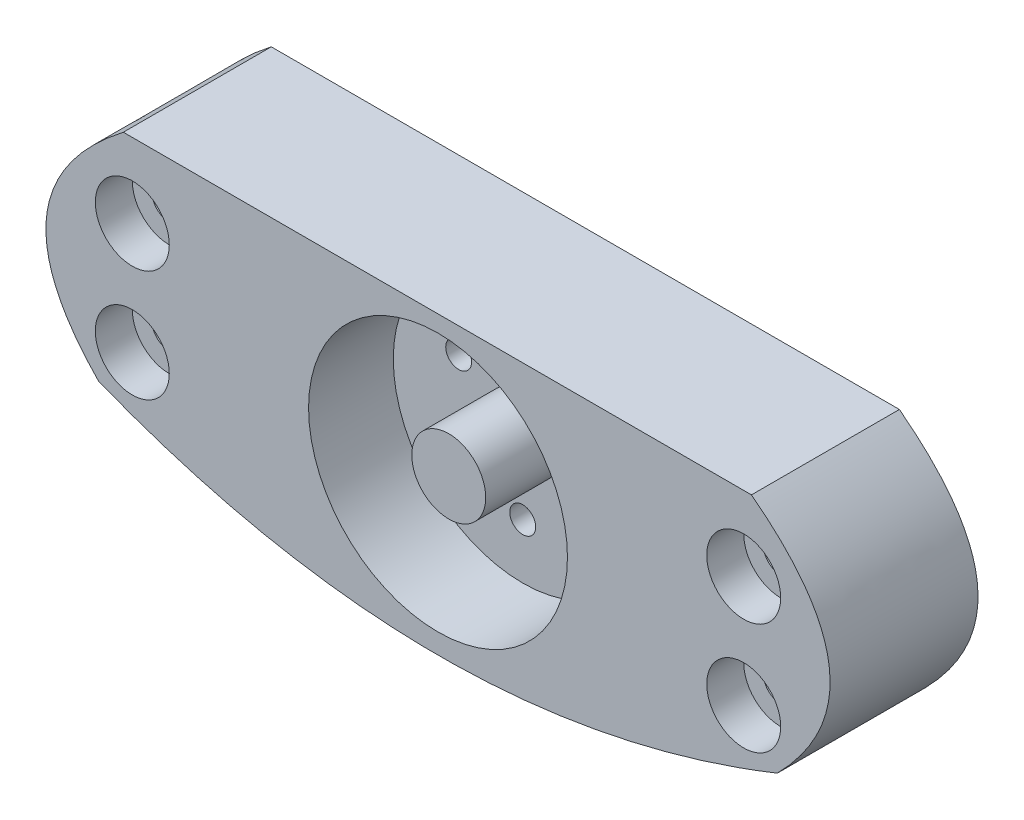
from build123d import *

# Parameters (mm, degrees)
BOSS_EXTRUDE1_DEPTH                              = 20
SKETCH4_R                                        = 17.5
CUT_EXTRUDE1_DEPTH                               = 11.453250926
SKETCH5_R                                        = 5
BOSS_EXTRUDE2_DEPTH                              = 10
CBORE_FOR_M5_HEX_HEAD_MACHINE_SCREW2_D           = 3.5
CBORE_FOR_M5_HEX_HEAD_MACHINE_SCREW2_DEPTH       = 11
CBORE_FOR_M5_HEX_HEAD_MACHINE_SCREW2_CBORE_D     = 7
CBORE_FOR_M5_HEX_HEAD_MACHINE_SCREW2_CBORE_DEPTH = 4
CBORE_FOR_M5_HEX_HEAD_MACHINE_SCREW2_TIP         = 1.75
CBORE_FOR_M5_HEX_HEAD_BOLT2_D                    = 4.7
CBORE_FOR_M5_HEX_HEAD_BOLT2_DEPTH                = 10
CBORE_FOR_M5_HEX_HEAD_BOLT2_CBORE_D              = 10
CBORE_FOR_M5_HEX_HEAD_BOLT2_CBORE_DEPTH          = 5
CBORE_FOR_M5_HEX_HEAD_BOLT2_TIP                  = 2.35


with BuildPart() as part:
    # Sketch2 → Boss-Extrude1 (new body)
    with BuildSketch(Plane.XY):
        with BuildLine():
            Line((42.376776125, 8.683218748), (-42.540089832, 8.683218747))
            add(Edge.make_bspline(
                [(-42.540089832, 8.683218747), (-61.647606257, -6.072667773), (-45.873698376, -22.15549797)],
                knots=[0, 0, 0, 1, 1, 1], degree=2))
            add(Edge.make_bspline(
                [(-45.873698376, -22.15549797), (0.203235462, -40.398996626), (45.873698397, -22.155497949)],
                knots=[0, 0, 0, 1, 1, 1], degree=2))
            add(Edge.make_bspline(
                [(45.873698397, -22.155497949), (61.713202875, -6.005950809), (42.376776125, 8.683218748)],
                knots=[0, 0, 0, 1, 1, 1], degree=2))
        make_face()
    extrude(amount=BOSS_EXTRUDE1_DEPTH)

    # Sketch4 → Cut-Extrude1 (cut)
    with BuildSketch(Plane.XY.offset(20)):
        with Locations((0, -11.063024907)):
            Circle(SKETCH4_R)
    extrude(amount=-CUT_EXTRUDE1_DEPTH, mode=Mode.SUBTRACT)

    # Sketch5 → Boss-Extrude2 (add)
    with BuildSketch(Plane.XY.offset(8.546749074)):
        with Locations((0, -11.063024907)):
            Circle(SKETCH5_R)
    extrude(amount=BOSS_EXTRUDE2_DEPTH)

    # CBORE for M5 Hex Head Machine Screw2
    with Locations(Plane(origin=(0, 0, 0), x_dir=(-1, 0, 0), z_dir=(0, 0, -1))):
        with Locations((-8.660254038, -6.129479586), (0, -21.129479586), (8.660254038, -6.129479586)):
            CounterBoreHole(CBORE_FOR_M5_HEX_HEAD_MACHINE_SCREW2_D / 2, CBORE_FOR_M5_HEX_HEAD_MACHINE_SCREW2_CBORE_D / 2, CBORE_FOR_M5_HEX_HEAD_MACHINE_SCREW2_CBORE_DEPTH, depth=CBORE_FOR_M5_HEX_HEAD_MACHINE_SCREW2_DEPTH)
            with Locations((0, 0, -(CBORE_FOR_M5_HEX_HEAD_MACHINE_SCREW2_DEPTH + CBORE_FOR_M5_HEX_HEAD_MACHINE_SCREW2_TIP / 2))):  # 90° drill point
                Cone(0, CBORE_FOR_M5_HEX_HEAD_MACHINE_SCREW2_D / 2, CBORE_FOR_M5_HEX_HEAD_MACHINE_SCREW2_TIP, mode=Mode.SUBTRACT)

    # CBORE for M5 Hex Head Bolt2
    with Locations(Plane.XY.offset(20)):
        with Locations((41.32946051, -1.400895634), (41.32946051, -16.479554433), (-41.32946051, -1.400895634), (-41.32946051, -16.479554433)):
            CounterBoreHole(CBORE_FOR_M5_HEX_HEAD_BOLT2_D / 2, CBORE_FOR_M5_HEX_HEAD_BOLT2_CBORE_D / 2, CBORE_FOR_M5_HEX_HEAD_BOLT2_CBORE_DEPTH, depth=CBORE_FOR_M5_HEX_HEAD_BOLT2_DEPTH)
            with Locations((0, 0, -(CBORE_FOR_M5_HEX_HEAD_BOLT2_DEPTH + CBORE_FOR_M5_HEX_HEAD_BOLT2_TIP / 2))):  # 90° drill point
                Cone(0, CBORE_FOR_M5_HEX_HEAD_BOLT2_D / 2, CBORE_FOR_M5_HEX_HEAD_BOLT2_TIP, mode=Mode.SUBTRACT)


solid = part.part
